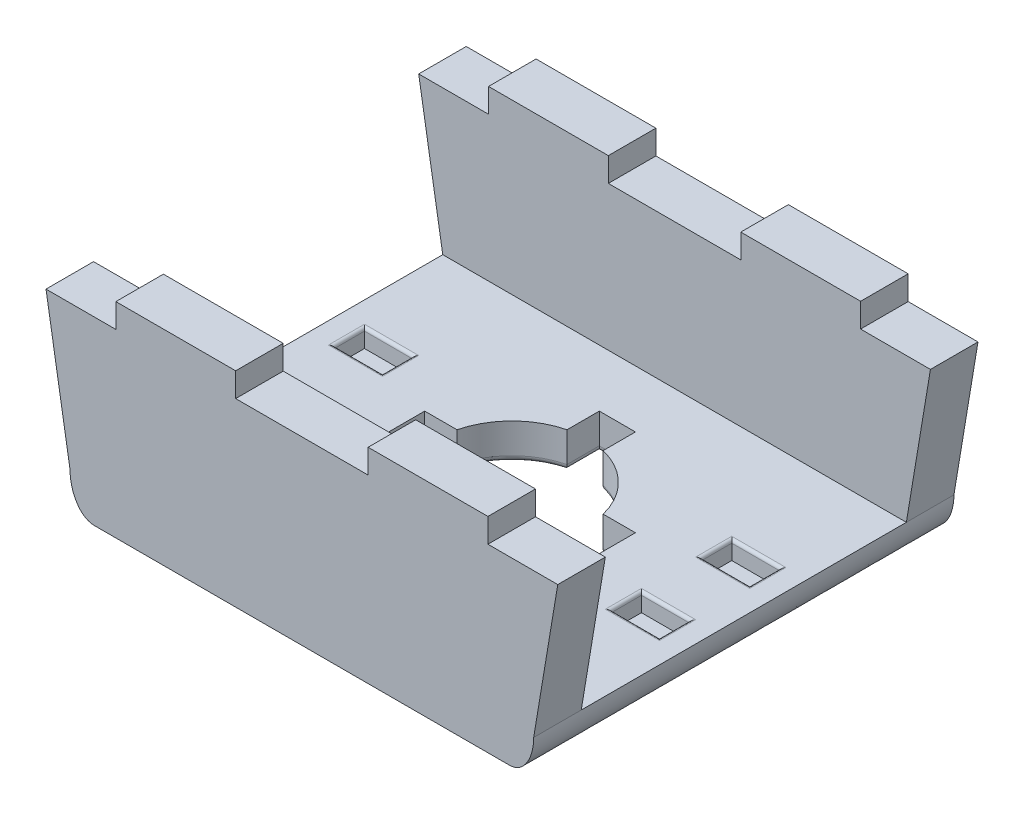
from build123d import *

# Parameters (mm, degrees)
SKETCH1_W             = 19.9
SKETCH1_H             = 7.9
BOSS_EXTRUDE1_DEPTH   = 4
BOSS_EXTRUDE1_2_DEPTH = 4
BOSS_EXTRUDE1_3_DEPTH = 4
BOSS_EXTRUDE1_4_DEPTH = 4
SKETCH2_W             = 85
SKETCH2_H             = 7.9
BOSS_EXTRUDE2_DEPTH   = 24
CHAMFER1_START        = -36
CHAMFER1_DEPTH        = 10
CHAMFER2_SIZE         = 24
CHAMFER2_SIZE_2       = 4
SKETCH4_W             = 77
SKETCH4_H             = 69.8
BOSS_EXTRUDE3_DEPTH   = 6
FILLET1_SIZE          = 6
FILLET1_SIZE_2        = 4
SKETCH7_W             = 8
SKETCH7_H             = 5
CUT_EXTRUDE3_DEPTH    = 65.654930379
SKETCH8_W             = 8
SKETCH8_H             = 20
BOSS_EXTRUDE4_DEPTH   = 3
SKETCH9_R             = 12.5
CUT_EXTRUDE4_DEPTH    = 65.654930379
CUT_EXTRUDE5_DEPTH    = 65.654930379
FILLET2_R             = 1
FILLET3_R             = 0.5


with BuildPart() as part:
    # Sketch1 → Boss-Extrude1 (new body)
    with BuildSketch(Plane(origin=(0, 0, 0), x_dir=(1, 0, 0), z_dir=(0, 1, 0))):
        with Locations((20.95, 30.95)):
            Rectangle(SKETCH1_W, SKETCH1_H)
    extrude(amount=BOSS_EXTRUDE1_DEPTH)



with BuildPart() as body_2:
    # Sketch1 → Boss-Extrude1 2 (new body)
    with BuildSketch(Plane(origin=(0, 0, 0), x_dir=(1, 0, 0), z_dir=(0, 1, 0))):
        with Locations((-20.95, -30.95)):
            Rectangle(SKETCH1_W, SKETCH1_H)
    extrude(amount=BOSS_EXTRUDE1_2_DEPTH)


with BuildPart() as body_3:
    # Sketch1 → Boss-Extrude1 3 (new body)
    with BuildSketch(Plane(origin=(0, 0, 0), x_dir=(1, 0, 0), z_dir=(0, 1, 0))):
        with Locations((20.95, -30.95)):
            Rectangle(SKETCH1_W, SKETCH1_H)
    extrude(amount=BOSS_EXTRUDE1_3_DEPTH)


with BuildPart() as body_4:
    # Sketch1 → Boss-Extrude1 4 (new body)
    with BuildSketch(Plane(origin=(0, 0, 0), x_dir=(1, 0, 0), z_dir=(0, 1, 0))):
        with Locations((-20.95, 30.95)):
            Rectangle(SKETCH1_W, SKETCH1_H)
    extrude(amount=BOSS_EXTRUDE1_4_DEPTH)


with BuildPart() as part_1:
    add(part.part)

    add(body_2.part)  # Boss-Extrude2 merges body 2

    add(body_3.part)  # Boss-Extrude2 merges body 3

    add(body_4.part)  # Boss-Extrude2 merges body 4
    # Sketch2 → Boss-Extrude2 (add)
    with BuildSketch(Plane(origin=(0, 0, 0), x_dir=(1, 0, 0), z_dir=(0, 1, 0))):
        with Locations((0, 30.95)):
            Rectangle(SKETCH2_W, SKETCH2_H)
        with Locations((0, -30.95)):
            Rectangle(SKETCH2_W, SKETCH2_H)
    extrude(amount=-BOSS_EXTRUDE2_DEPTH)

    # Chamfer1: read off the stored shape, not the designer's step
    # Chamfer1 outline → Chamfer1 (cut)
    with BuildSketch(Plane.XY.offset(CHAMFER1_START)):
        Polygon((-42.5, -24), (-38.5, -24), (-42.5, 0), align=None)
        Polygon((42.5, 0), (38.5, -24), (42.5, -24), align=None)
    extrude(amount=CHAMFER1_DEPTH, mode=Mode.SUBTRACT)

    # Chamfer2
    # the kernel refuses this chamfer: 24, 4 mm, written as the material it takes off along each edge
    with BuildSketch(Plane(origin=(42.5, -24, -35.368593459), x_dir=(0, 1, 0), z_dir=(0, 0, 1))) as chamfer2_piece_1:
        Polygon((CHAMFER2_SIZE, 0), (0, CHAMFER2_SIZE_2), (0, 0), align=None)
    extrude(amount=132.637186918, mode=Mode.SUBTRACT)
    with BuildSketch(Plane(origin=(-42.5, -24, 97.268593459), x_dir=(1, 0, 0), z_dir=(0, 0, -1))) as chamfer2_piece_2:
        Polygon((CHAMFER2_SIZE_2, 0), (0, -CHAMFER2_SIZE), (0, 0), align=None)
    extrude(amount=132.637186918, mode=Mode.SUBTRACT)

    # Sketch4 → Boss-Extrude3 (add)
    with BuildSketch(Plane.XZ.offset(24)):
        Rectangle(SKETCH4_W, SKETCH4_H)
    extrude(amount=BOSS_EXTRUDE3_DEPTH)

    # Fillet1
    # a fillet whose section is not a circle: 6, 4 mm, written as the material it takes off along each edge
    with BuildSketch(Plane(origin=(38.5, -30, -49.9), x_dir=(0, 1, 0), z_dir=(0, 0, 1)), Plane(origin=(-38.5, -30, 49.9), x_dir=(0, 1, 0), z_dir=(0, 0, -1))) as fillet1_piece_1:
        with BuildLine():
            Bezier((FILLET1_SIZE, 0), (0, 0), (0, FILLET1_SIZE_2), weights=[1, 0.707106781, 1])
            Line((0, FILLET1_SIZE_2), (0, 0))
            Line((0, 0), (FILLET1_SIZE, 0))
        make_face()
    extrude(amount=99.8, mode=Mode.SUBTRACT)

    # Sketch7 → Cut-Extrude3 (cut, through all)
    with BuildSketch(Plane.XZ.offset(30)):
        with Locations((-30.5, -7.5)):
            Rectangle(SKETCH7_W, SKETCH7_H)
        with Locations((-30.5, 7.5)):
            Rectangle(SKETCH7_W, SKETCH7_H)
        with Locations((30.5, 7.5)):
            Rectangle(SKETCH7_W, SKETCH7_H)
        with Locations((30.5, -7.5)):
            Rectangle(SKETCH7_W, SKETCH7_H)
    extrude(amount=-CUT_EXTRUDE3_DEPTH, mode=Mode.SUBTRACT)

    # Sketch8 → Boss-Extrude4 (add)
    with BuildSketch(Plane.XZ.offset(30)):
        with Locations((-30.5, 0)):
            Rectangle(SKETCH8_W, SKETCH8_H)
        with Locations((30.5, 0)):
            Rectangle(SKETCH8_W, SKETCH8_H)
    extrude(amount=-BOSS_EXTRUDE4_DEPTH)

    # Sketch9 → Cut-Extrude4 (cut, through all)
    with BuildSketch(Plane.XZ.offset(30)):
        with Locations(Location((0, 0, 0), (0, 0, 270))):
            Circle(SKETCH9_R)
    extrude(amount=-CUT_EXTRUDE4_DEPTH, mode=Mode.SUBTRACT)

    # Sketch10 → Cut-Extrude5 (cut, through all)
    with BuildSketch(Plane.XZ.offset(30)):
        Polygon((3, 3), (17.5, 3), (17.5, -3), (3, -3), (3, -17.5), (-3, -17.5), (-3, -3), (-17.5, -3), (-17.5, 3), (-3, 3), (-3, 17.5), (3, 17.5), align=None)
    extrude(amount=-CUT_EXTRUDE5_DEPTH, mode=Mode.SUBTRACT)

    # Fillet2
    fillet2_edges = [part_1.edges().sort_by_distance(p)[0] for p in [
        (8.838834765, -30, -8.838834765),
        (8.838834765, -30, 8.838834765),
        (-8.838834765, -30, 8.838834765),
        (-8.838834765, -30, -8.838834765),
        (-17.5, -30, 0),
        (-14.81733055, -30, -3),
        (0, -30, -17.5),
        (3, -30, -14.81733055),
        (14.81733055, -30, -3),
        (3, -30, 14.81733055),
        (-3, -30, -14.81733055),
        (-14.81733055, -30, 3),
        (-3, -30, 14.81733055),
        (0, -30, 17.5),
        (14.81733055, -30, 3),
        (17.5, -30, 0),
    ]]
    fillet(fillet2_edges, radius=FILLET2_R)

    # Fillet3
    fillet3_edges = [part_1.edges().sort_by_distance(p)[0] for p in [
        (26.5, -24, 7.5),
        (30.5, -24, 5),
        (30.5, -24, 10),
        (34.5, -24, 7.5),
        (26.5, -24, -7.5),
        (30.5, -24, -10),
        (30.5, -24, -5),
        (34.5, -24, -7.5),
        (-30.5, -24, -10),
        (-34.5, -24, -7.5),
        (-30.5, -24, -5),
        (-26.5, -24, -7.5),
        (-26.5, -24, 7.5),
        (-34.5, -24, 7.5),
        (-30.5, -24, 10),
        (-30.5, -24, 5),
    ]]
    fillet(fillet3_edges, radius=FILLET3_R)


solid = part_1.part
